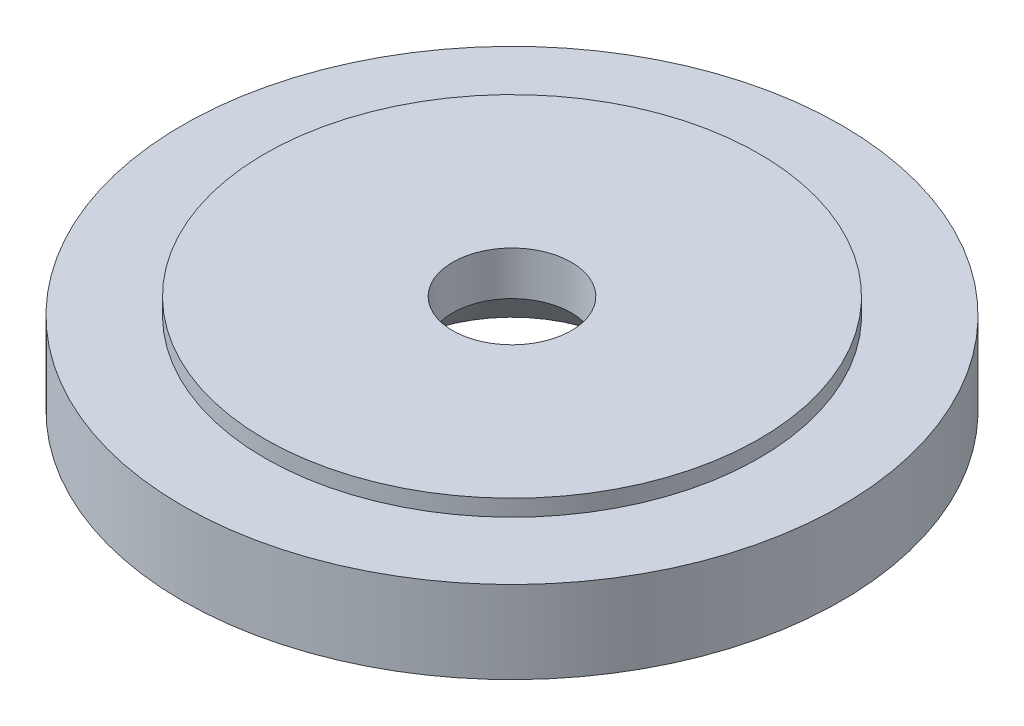
from build123d import *

# Parameters (mm, degrees)
SKETCH1_R           = 10
BOSS_EXTRUDE1_DEPTH = 2.5
SKETCH2_R           = 7.5
BOSS_EXTRUDE2_DEPTH = 0.5


with BuildPart() as part:
    # Sketch1 → Boss-Extrude1 (new body)
    with BuildSketch(Plane(origin=(0, 0, 0), x_dir=(1, 0, 0), z_dir=(0, 1, 0))):
        Circle(SKETCH1_R)
    extrude(amount=BOSS_EXTRUDE1_DEPTH)

    # Sketch2 → Boss-Extrude2 (add)
    with BuildSketch(Plane(origin=(0, 2.5, 0), x_dir=(1, 0, 0), z_dir=(0, 1, 0))):
        Circle(SKETCH2_R)
    extrude(amount=BOSS_EXTRUDE2_DEPTH)

    # Sketch4 → CSK for M3 Hex Socket Countersunk Head Screw1 (revolve, cut)
    with BuildSketch(Plane(origin=(0, 0, 0), x_dir=(0, 0, -1), z_dir=(1, 0, 0))):
        Polygon((0, 0), (0, 3), (1.8, 3), (1.8, 1.67), (3.47, 0), align=None)
    revolve(axis=Axis((0, -6.35, 0), (0, 1, 0)), mode=Mode.SUBTRACT)


solid = part.part
